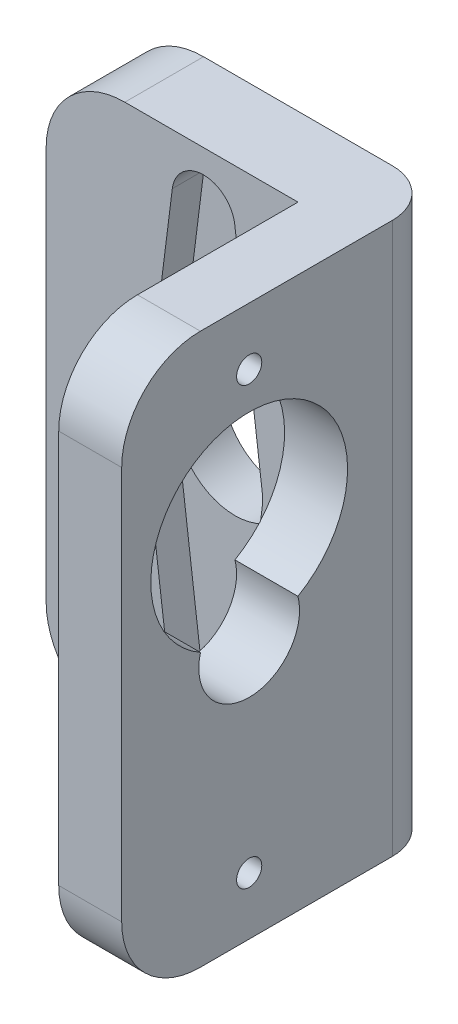
from build123d import *

# Parameters (mm, degrees)
SKETCH1_R           = 3.75
BOSS_EXTRUDE1_DEPTH = 5
CUT_EXTRUDE2_DEPTH  = 2
SKETCH5_R           = 0.8
BOSS_EXTRUDE2_DEPTH = 4
FILLET1_R           = 3


with BuildPart() as part:
    # Sketch1 → Boss-Extrude1 (new body)
    with BuildSketch(Plane.XY):
        with BuildLine():
            Line((10, -17.5), (-5, -17.5))
            ThreePointArc((-5, -17.5), (-8.535533906, -16.035533906), (-10, -12.5))
            Line((-10, -12.5), (-10, 12.5))
            ThreePointArc((-10, 12.5), (-8.535533906, 16.035533906), (-5, 17.5))
            Line((-5, 17.5), (10, 17.5))
            Line((10, 17.5), (10, -17.5))
        make_face()
        Circle(SKETCH1_R, mode=Mode.SUBTRACT)
    extrude(amount=-BOSS_EXTRUDE1_DEPTH)

    # Sketch3 → Cut-Extrude2 (cut)
    with BuildSketch(Plane.XY):
        with BuildLine():
            Line((-1.984313483, 14.25), (-3.720587781, 0.46875))
            ThreePointArc((-3.720587781, 0.46875), (-3.75, 0), (-3.720587781, -0.46875))
            Line((-3.720587781, -0.46875), (-1.984313483, -14.25))
            ThreePointArc((-1.984313483, -14.25), (0, -16), (1.984313483, -14.25))
            Line((1.984313483, -14.25), (3.720587781, -0.46875))
            ThreePointArc((3.720587781, -0.46875), (3.75, 0), (3.720587781, 0.46875))
            Line((3.720587781, 0.46875), (1.984313483, 14.25))
            ThreePointArc((1.984313483, 14.25), (0, 16), (-1.984313483, 14.25))
        make_face()
    extrude(amount=-CUT_EXTRUDE2_DEPTH, mode=Mode.SUBTRACT)

    # Sketch5 → Boss-Extrude2 (add)
    with BuildSketch(Plane(origin=(10, 0, 0), x_dir=(0, 0, -1), z_dir=(1, 0, 0))):
        with BuildLine():
            Line((5, 17.5), (-10.2, 17.5))
            ThreePointArc((-10.2, 17.5), (-13.735533906, 16.035533906), (-15.2, 12.5))
            Line((-15.2, 12.5), (-15.2, -12.5))
            ThreePointArc((-15.2, -12.5), (-13.735533906, -16.035533906), (-10.2, -17.5))
            Line((-10.2, -17.5), (5, -17.5))
            Line((5, -17.5), (5, 17.5))
        make_face()
        with Locations((-7.1, 13.85)):
            Circle(SKETCH5_R, mode=Mode.SUBTRACT)
        with Locations((-7.1, -13.85)):
            Circle(SKETCH5_R, mode=Mode.SUBTRACT)
        with BuildLine():
            ThreePointArc((-4.006634299, -0.1808), (-7.1, 11.5), (-10.193365701, -0.1808))
            ThreePointArc((-10.193365701, -0.1808), (-7.1, -4.2), (-4.006634299, -0.1808))
        make_face(mode=Mode.SUBTRACT)
    extrude(amount=-BOSS_EXTRUDE2_DEPTH)

    # Fillet1
    fillet1_edges = [part.edges().sort_by_distance(p)[0] for p in [
        (10, 0, -5),
    ]]
    fillet(fillet1_edges, radius=FILLET1_R)


solid = part.part
